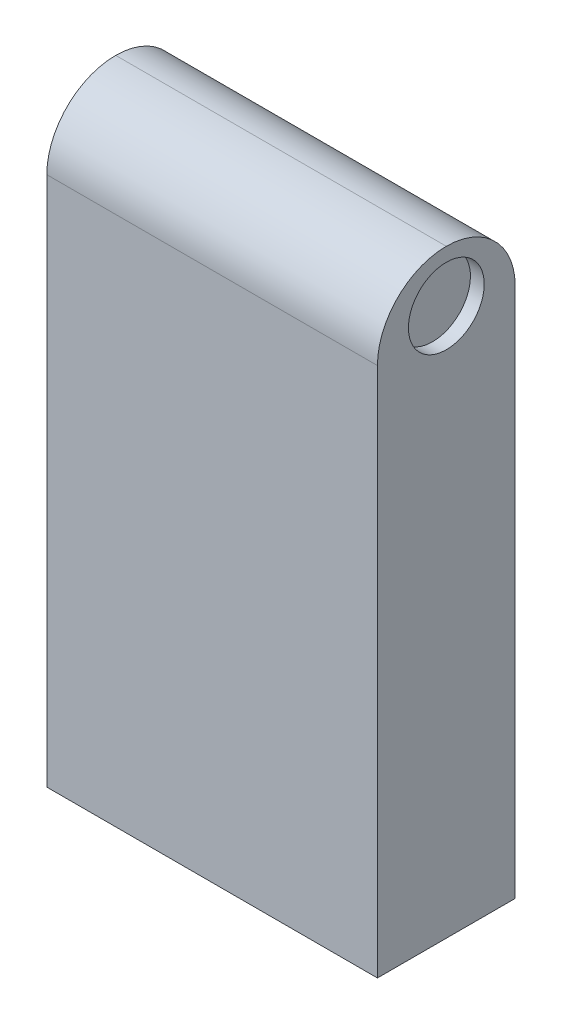
from build123d import *

# Parameters (mm, degrees)
SKETCH1_W           = 24
SKETCH1_H           = 43.5
BOSS_EXTRUDE1_DEPTH = 10
FILLET1_R           = 5
SKETCH2_R           = 2.75
CUT_EXTRUDE1_DEPTH  = 1


with BuildPart() as part:
    # Sketch1 → Boss-Extrude1 (new body)
    with BuildSketch(Plane.XY):
        with Locations((12, 21.75)):
            Rectangle(SKETCH1_W, SKETCH1_H)
    extrude(amount=BOSS_EXTRUDE1_DEPTH)

    # Fillet1
    fillet1_edges = [part.edges().sort_by_distance(p)[0] for p in [
        (12, 43.5, 0),
        (12, 43.5, 10),
    ]]
    fillet(fillet1_edges, radius=FILLET1_R - 0.0001)  # a hair under: the kernel refuses the full size

    # Sketch2 → Cut-Extrude1 (cut)
    with BuildSketch(Plane(origin=(24, 0, 0), x_dir=(0, 0, -1), z_dir=(1, 0, 0))):
        with Locations(Location((-5, 39.745423447, 0), (0, 0, 90))):
            Circle(SKETCH2_R)
    extrude(amount=-CUT_EXTRUDE1_DEPTH, mode=Mode.SUBTRACT)


solid = part.part
